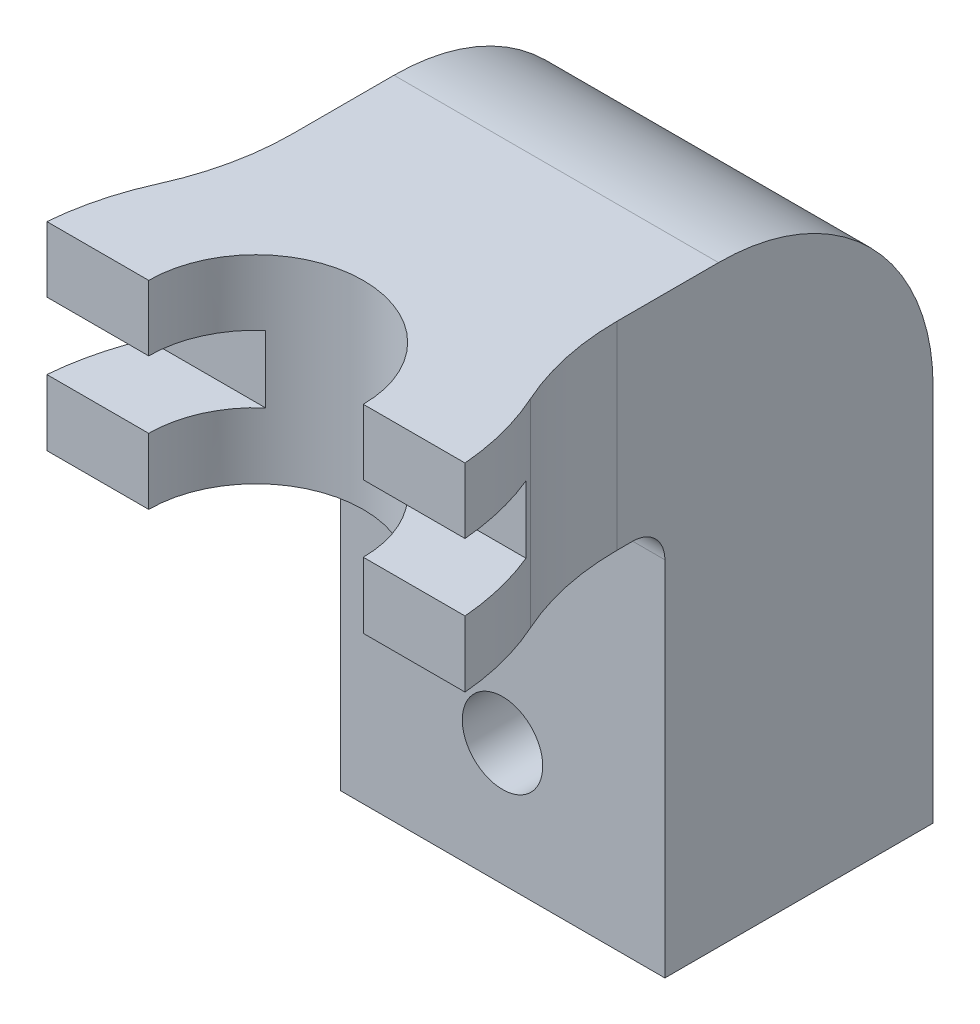
from build123d import *

# Parameters (mm, degrees)
IZIM1_W                     = 12.1
IZIM1_H                     = 22.1
Y_KSEKLIK_EKSTR_ZYON1_DEPTH = 10
IZIM2_W                     = 8.25
IZIM2_H                     = 5.25
KES_EKSTR_ZYON1_DEPTH       = 18
IZIM3_R                     = 1.5
KES_EKSTR_ZYON2_DEPTH       = 17.084309124
IZIM4_W                     = 9.196571059
IZIM4_H                     = 7.396734232
Y_KSEKLIK_EKSTR_ZYON2_DEPTH = 12.1
IZIM6_W                     = 3.5
IZIM6_H                     = 2.438999841
IZIM6_H_2                   = 2.5
IZIM6_H_3                   = 2.457734391
IZIM6_W_2                   = 4.3
KES_EKSTR_ZYON3_DEPTH       = 3
RADYUS1_R                   = 1.2
RADYUS2_R                   = 8
IZIM7_R                     = 4
KES_EKSTR_ZYON4_DEPTH       = 10
IZIM8_W                     = 1.744878744
IZIM8_H                     = 1.717356621
Y_KSEKLIK_EKSTR_ZYON3_DEPTH = 7.396734232
KES_EKSTR_ZYON5_DEPTH       = 50
KES_EKSTR_ZYON5_DEPTH_BACK  = 50
IZIM9_W                     = 3
IZIM9_H                     = 2.5
RADYUS3_R                   = 10
RADYUS4_START               = 3
RADYUS4_DEPTH               = 9


with BuildPart() as part:
    # Çizim1 → Yükseklik-Ekstrüzyon1 (new body)
    with BuildSketch(Plane.XY):
        Rectangle(IZIM1_W, IZIM1_H)
    extrude(amount=Y_KSEKLIK_EKSTR_ZYON1_DEPTH)

    # Çizim2 → Kes-Ekstrüzyon1 (cut)
    with BuildSketch(Plane.XZ.offset(11.05)):
        with Locations((0, 5)):
            Rectangle(IZIM2_W, IZIM2_H)
    extrude(amount=-KES_EKSTR_ZYON1_DEPTH, mode=Mode.SUBTRACT)

    # Çizim3 → Kes-Ekstrüzyon2 (cut, through all)
    with BuildSketch(Plane(origin=(0, 0, 0), x_dir=(-1, 0, 0), z_dir=(0, 0, -1))):
        with Locations((0.004348468, -6.489526702)):
            Circle(IZIM3_R)
        with Locations((0.004348468, 0.010473298)):
            Circle(IZIM3_R)
    extrude(amount=-KES_EKSTR_ZYON2_DEPTH, mode=Mode.SUBTRACT)

    # Çizim4 → Yükseklik-Ekstrüzyon2 (add, through all)
    with BuildSketch(Plane.ZY.offset(6.05)):
        with Locations((14.59828553, 7.351632884)):
            Rectangle(IZIM4_W, IZIM4_H)
    extrude(amount=-Y_KSEKLIK_EKSTR_ZYON2_DEPTH)

    # Çizim6 → Kes-Ekstrüzyon3 (cut)
    with BuildSketch(Plane.XY.offset(19.196571059)):
        with Locations((0, 9.83050008)):
            Rectangle(IZIM6_W, IZIM6_H)
        with Locations((0, 7.361000159)):
            Rectangle(IZIM6_W, IZIM6_H_2)
        with Locations((0, 4.882132964)):
            Rectangle(IZIM6_W, IZIM6_H_3)
        with Locations((3.9, 7.361000159)):
            Rectangle(IZIM6_W_2, IZIM6_H_2)
        with Locations((-3.9, 7.361000159)):
            Rectangle(IZIM6_W_2, IZIM6_H_2)
    extrude(amount=-KES_EKSTR_ZYON3_DEPTH, mode=Mode.SUBTRACT)

    # Radyus1
    radyus1_edges = [part.edges().sort_by_distance(p)[0] for p in [
        (0, 3.653265768, 10),
    ]]
    fillet(radyus1_edges, radius=RADYUS1_R)

    # Radyus2
    radyus2_edges = [part.edges().sort_by_distance(p)[0] for p in [
        (0, 11.05, 0),
    ]]
    fillet(radyus2_edges, radius=RADYUS2_R)

    # Çizim7 → Kes-Ekstrüzyon4 (cut)
    with BuildSketch(Plane(origin=(0, 11.05, 0), x_dir=(1, 0, 0), z_dir=(0, 1, 0))):
        with Locations((0, -19.196571059)):
            Circle(IZIM7_R)
    extrude(amount=-KES_EKSTR_ZYON4_DEPTH, mode=Mode.SUBTRACT)

    # Çizim8 → Yükseklik-Ekstrüzyon3 (add)
    with BuildSketch(Plane(origin=(0, 11.05, 0), x_dir=(1, 0, 0), z_dir=(0, 1, 0))):
        with Locations((-6.922439372, -18.337892748)):
            Rectangle(IZIM8_W, IZIM8_H)
        Polygon((-6.05, -14.458244553), (-7.794878744, -17.479214438), (-6.05, -17.479214438), align=None)
        Polygon((6.05, -17.479214438), (7.794878744, -17.479214438), (6.05, -14.458244553), align=None)
        with Locations((6.922439372, -18.337892748)):
            Rectangle(IZIM8_W, IZIM8_H)
    extrude(amount=-Y_KSEKLIK_EKSTR_ZYON3_DEPTH)

    # Çizim9 → Kes-Ekstrüzyon5 (cut, two sides: drawn at the far end of the back side and taken through both)
    with BuildSketch(Plane.ZY.offset(-6.05).offset(-KES_EKSTR_ZYON5_DEPTH_BACK)):
        with Locations((17.696571059, 7.361000159)):
            Rectangle(IZIM9_W, IZIM9_H)
    extrude(amount=KES_EKSTR_ZYON5_DEPTH + KES_EKSTR_ZYON5_DEPTH_BACK, mode=Mode.SUBTRACT)

    # Radyus3
    # the kernel refuses this fillet: 10 mm, written as the material it adds along each edge
    with BuildSketch(Plane(origin=(6.05, 11.05, 14.458244553), x_dir=(0, 0, -1), z_dir=(0, -1, 0))) as radyus3_piece_1_section:
        with BuildLine():
            CenterArc((RADYUS3_R * 0.268045105611, RADYUS3_R), RADYUS3_R, 239.989745652, 30.010254348)
            Line((-RADYUS3_R * 0.232109880799, RADYUS3_R * 0.134064096154), (0, 0))
            Line((0, 0), (RADYUS3_R * 0.268045105611, 0))
        make_face()
    radyus3_piece_1 = extrude(amount=7.396734232, mode=Mode.PRIVATE)
    radyus3_piece_1 = split(radyus3_piece_1, bisect_by=Plane(origin=(6.05, 8.611000159, 14.458244553), z_dir=(0, 1, 0)), keep=Keep.TOP, mode=Mode.PRIVATE)
    radyus3_piece_1 = split(radyus3_piece_1, bisect_by=Plane(origin=(6.05, 11.05, 16.196571059), z_dir=(0, 0, -1)), keep=Keep.TOP, mode=Mode.PRIVATE)
    add(radyus3_piece_1)
    with BuildSketch(Plane(origin=(6.05, 11.05, 14.458244553), x_dir=(0, 0, -1), z_dir=(0, -1, 0))) as radyus3_piece_2_section:
        with BuildLine():
            CenterArc((RADYUS3_R * 0.268045105611, RADYUS3_R), RADYUS3_R, 239.989745652, 30.010254348)
            Line((-RADYUS3_R * 0.232109880799, RADYUS3_R * 0.134064096154), (0, 0))
            Line((0, 0), (RADYUS3_R * 0.268045105611, 0))
        make_face()
    radyus3_piece_2 = extrude(amount=7.396734232, mode=Mode.PRIVATE)
    radyus3_piece_2 = split(radyus3_piece_2, bisect_by=Plane(origin=(6.05, 8.611000159, 14.458244553), z_dir=(0, 1, 0)), keep=Keep.TOP, mode=Mode.PRIVATE)
    radyus3_piece_2 = split(radyus3_piece_2, bisect_by=Plane(origin=(6.05, 11.05, 16.196571059), z_dir=(0, 0, 1)), keep=Keep.TOP, mode=Mode.PRIVATE)
    add(radyus3_piece_2)
    with BuildSketch(Plane(origin=(6.05, 11.05, 14.458244553), x_dir=(0, 0, -1), z_dir=(0, -1, 0))) as radyus3_piece_3_section:
        with BuildLine():
            CenterArc((RADYUS3_R * 0.268045105611, RADYUS3_R), RADYUS3_R, 239.989745652, 30.010254348)
            Line((-RADYUS3_R * 0.232109880799, RADYUS3_R * 0.134064096154), (0, 0))
            Line((0, 0), (RADYUS3_R * 0.268045105611, 0))
        make_face()
    radyus3_piece_3 = extrude(amount=7.396734232, mode=Mode.PRIVATE)
    radyus3_piece_3 = split(radyus3_piece_3, bisect_by=Plane(origin=(6.05, 8.611000159, 14.458244553), z_dir=(0, -1, 0)), keep=Keep.TOP, mode=Mode.PRIVATE)
    radyus3_piece_3 = split(radyus3_piece_3, bisect_by=Plane(origin=(6.05, 11.05, 16.196571059), z_dir=(0, 0, -1)), keep=Keep.TOP, mode=Mode.PRIVATE)
    radyus3_piece_3 = split(radyus3_piece_3, bisect_by=Plane(origin=(6.05, 6.111000159, 14.458244553), z_dir=(0, 1, 0)), keep=Keep.TOP, mode=Mode.PRIVATE)
    add(radyus3_piece_3)
    with BuildSketch(Plane(origin=(6.05, 11.05, 14.458244553), x_dir=(0, 0, -1), z_dir=(0, -1, 0))) as radyus3_piece_4_section:
        with BuildLine():
            CenterArc((RADYUS3_R * 0.268045105611, RADYUS3_R), RADYUS3_R, 239.989745652, 30.010254348)
            Line((-RADYUS3_R * 0.232109880799, RADYUS3_R * 0.134064096154), (0, 0))
            Line((0, 0), (RADYUS3_R * 0.268045105611, 0))
        make_face()
    radyus3_piece_4 = extrude(amount=7.396734232, mode=Mode.PRIVATE)
    radyus3_piece_4 = split(radyus3_piece_4, bisect_by=Plane(origin=(6.05, 11.05, 16.196571059), z_dir=(0, 0, -1)), keep=Keep.TOP, mode=Mode.PRIVATE)
    radyus3_piece_4 = split(radyus3_piece_4, bisect_by=Plane(origin=(6.05, 6.111000159, 14.458244553), z_dir=(0, -1, 0)), keep=Keep.TOP, mode=Mode.PRIVATE)
    add(radyus3_piece_4)
    with BuildSketch(Plane(origin=(6.05, 11.05, 14.458244553), x_dir=(0, 0, -1), z_dir=(0, -1, 0))) as radyus3_piece_5_section:
        with BuildLine():
            CenterArc((RADYUS3_R * 0.268045105611, RADYUS3_R), RADYUS3_R, 239.989745652, 30.010254348)
            Line((-RADYUS3_R * 0.232109880799, RADYUS3_R * 0.134064096154), (0, 0))
            Line((0, 0), (RADYUS3_R * 0.268045105611, 0))
        make_face()
    radyus3_piece_5 = extrude(amount=7.396734232, mode=Mode.PRIVATE)
    radyus3_piece_5 = split(radyus3_piece_5, bisect_by=Plane(origin=(6.05, 11.05, 16.196571059), z_dir=(0, 0, 1)), keep=Keep.TOP, mode=Mode.PRIVATE)
    radyus3_piece_5 = split(radyus3_piece_5, bisect_by=Plane(origin=(6.05, 6.111000159, 14.458244553), z_dir=(0, -1, 0)), keep=Keep.TOP, mode=Mode.PRIVATE)
    add(radyus3_piece_5)
    with BuildSketch(Plane(origin=(-6.05, 11.05, 14.458244553), x_dir=(0, 0, -1), z_dir=(0, -1, 0))) as radyus3_piece_6_section:
        with BuildLine():
            CenterArc((RADYUS3_R * 0.268045105611, -RADYUS3_R), RADYUS3_R, 90, 30.010254348)
            Line((-RADYUS3_R * 0.232109880799, -RADYUS3_R * 0.134064096154), (0, 0))
            Line((0, 0), (RADYUS3_R * 0.268045105611, 0))
        make_face()
    radyus3_piece_6 = extrude(amount=7.396734232, mode=Mode.PRIVATE)
    radyus3_piece_6 = split(radyus3_piece_6, bisect_by=Plane(origin=(-6.05, 8.611000159, 14.458244553), z_dir=(0, 1, 0)), keep=Keep.TOP, mode=Mode.PRIVATE)
    radyus3_piece_6 = split(radyus3_piece_6, bisect_by=Plane(origin=(-6.05, 11.05, 16.196571059), z_dir=(0, 0, -1)), keep=Keep.TOP, mode=Mode.PRIVATE)
    add(radyus3_piece_6)
    with BuildSketch(Plane(origin=(-6.05, 11.05, 14.458244553), x_dir=(0, 0, -1), z_dir=(0, -1, 0))) as radyus3_piece_7_section:
        with BuildLine():
            CenterArc((RADYUS3_R * 0.268045105611, -RADYUS3_R), RADYUS3_R, 90, 30.010254348)
            Line((-RADYUS3_R * 0.232109880799, -RADYUS3_R * 0.134064096154), (0, 0))
            Line((0, 0), (RADYUS3_R * 0.268045105611, 0))
        make_face()
    radyus3_piece_7 = extrude(amount=7.396734232, mode=Mode.PRIVATE)
    radyus3_piece_7 = split(radyus3_piece_7, bisect_by=Plane(origin=(-6.05, 8.611000159, 14.458244553), z_dir=(0, 1, 0)), keep=Keep.TOP, mode=Mode.PRIVATE)
    radyus3_piece_7 = split(radyus3_piece_7, bisect_by=Plane(origin=(-6.05, 11.05, 16.196571059), z_dir=(0, 0, 1)), keep=Keep.TOP, mode=Mode.PRIVATE)
    add(radyus3_piece_7)
    with BuildSketch(Plane(origin=(-6.05, 11.05, 14.458244553), x_dir=(0, 0, -1), z_dir=(0, -1, 0))) as radyus3_piece_8_section:
        with BuildLine():
            CenterArc((RADYUS3_R * 0.268045105611, -RADYUS3_R), RADYUS3_R, 90, 30.010254348)
            Line((-RADYUS3_R * 0.232109880799, -RADYUS3_R * 0.134064096154), (0, 0))
            Line((0, 0), (RADYUS3_R * 0.268045105611, 0))
        make_face()
    radyus3_piece_8 = extrude(amount=7.396734232, mode=Mode.PRIVATE)
    radyus3_piece_8 = split(radyus3_piece_8, bisect_by=Plane(origin=(-6.05, 8.611000159, 14.458244553), z_dir=(0, -1, 0)), keep=Keep.TOP, mode=Mode.PRIVATE)
    radyus3_piece_8 = split(radyus3_piece_8, bisect_by=Plane(origin=(-6.05, 11.05, 16.196571059), z_dir=(0, 0, -1)), keep=Keep.TOP, mode=Mode.PRIVATE)
    radyus3_piece_8 = split(radyus3_piece_8, bisect_by=Plane(origin=(-6.05, 6.111000159, 14.458244553), z_dir=(0, 1, 0)), keep=Keep.TOP, mode=Mode.PRIVATE)
    add(radyus3_piece_8)
    with BuildSketch(Plane(origin=(-6.05, 11.05, 14.458244553), x_dir=(0, 0, -1), z_dir=(0, -1, 0))) as radyus3_piece_9_section:
        with BuildLine():
            CenterArc((RADYUS3_R * 0.268045105611, -RADYUS3_R), RADYUS3_R, 90, 30.010254348)
            Line((-RADYUS3_R * 0.232109880799, -RADYUS3_R * 0.134064096154), (0, 0))
            Line((0, 0), (RADYUS3_R * 0.268045105611, 0))
        make_face()
    radyus3_piece_9 = extrude(amount=7.396734232, mode=Mode.PRIVATE)
    radyus3_piece_9 = split(radyus3_piece_9, bisect_by=Plane(origin=(-6.05, 11.05, 16.196571059), z_dir=(0, 0, -1)), keep=Keep.TOP, mode=Mode.PRIVATE)
    radyus3_piece_9 = split(radyus3_piece_9, bisect_by=Plane(origin=(-6.05, 6.111000159, 14.458244553), z_dir=(0, -1, 0)), keep=Keep.TOP, mode=Mode.PRIVATE)
    add(radyus3_piece_9)
    with BuildSketch(Plane(origin=(-6.05, 11.05, 14.458244553), x_dir=(0, 0, -1), z_dir=(0, -1, 0))) as radyus3_piece_10_section:
        with BuildLine():
            CenterArc((RADYUS3_R * 0.268045105611, -RADYUS3_R), RADYUS3_R, 90, 30.010254348)
            Line((-RADYUS3_R * 0.232109880799, -RADYUS3_R * 0.134064096154), (0, 0))
            Line((0, 0), (RADYUS3_R * 0.268045105611, 0))
        make_face()
    radyus3_piece_10 = extrude(amount=7.396734232, mode=Mode.PRIVATE)
    radyus3_piece_10 = split(radyus3_piece_10, bisect_by=Plane(origin=(-6.05, 11.05, 16.196571059), z_dir=(0, 0, 1)), keep=Keep.TOP, mode=Mode.PRIVATE)
    radyus3_piece_10 = split(radyus3_piece_10, bisect_by=Plane(origin=(-6.05, 6.111000159, 14.458244553), z_dir=(0, -1, 0)), keep=Keep.TOP, mode=Mode.PRIVATE)
    add(radyus3_piece_10)

    # Radyus4: read off the stored shape, not the designer's step
    # Radyus4 outline → Radyus4 (cut)
    with BuildSketch(Plane(origin=(0, 0, 0), x_dir=(1, 0, 0), z_dir=(0, 1, 0)).offset(RADYUS4_START)):
        with BuildLine():
            ThreePointArc((-7.794878744, -19.196571059), (-7.508526716, -17.512091406), (-6.939589091, -15.900949214))
            ThreePointArc((-6.939589091, -15.900949214), (-7.154266469, -16.345716978), (-7.390640962, -16.779343361))
            Line((-7.390640962, -16.779343361), (-7.794878744, -17.479214438))
            Line((-7.794878744, -17.479214438), (-7.794878744, -19.196571059))
        make_face()
        with BuildLine():
            ThreePointArc((6.939589091, -15.900949214), (7.508526716, -17.512091406), (7.794878744, -19.196571059))
            Line((7.794878744, -19.196571059), (7.794878744, -17.479214438))
            Line((7.794878744, -17.479214438), (7.390640962, -16.779343361))
            ThreePointArc((7.390640962, -16.779343361), (7.154266469, -16.345716978), (6.939589091, -15.900949214))
        make_face()
    extrude(amount=RADYUS4_DEPTH, mode=Mode.SUBTRACT)


solid = part.part
